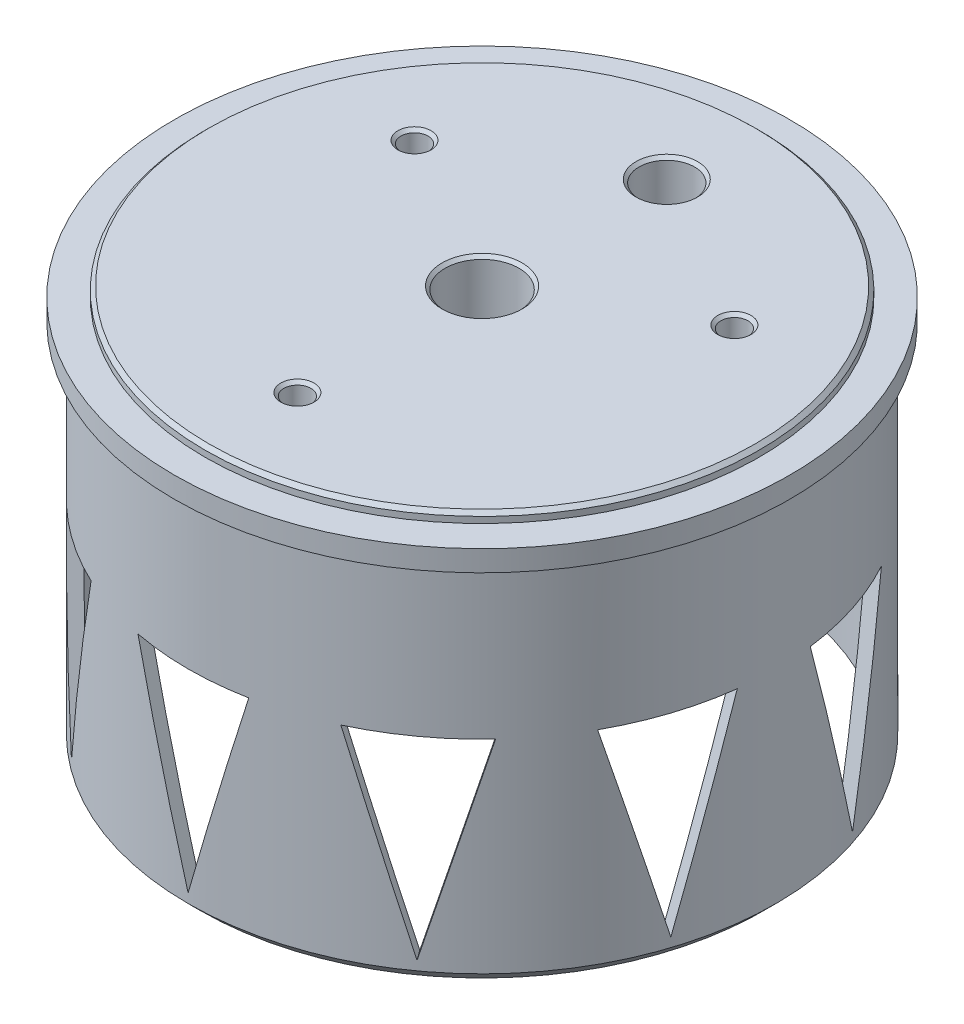
from build123d import *
from build123d.topology import SkipClean

# Parameters (mm, degrees)
CUT_EXTRUDE_748_DEPTH      = 70.85
PATTERN_CIRCULAR_802_COUNT = 5
SKETCH_7_R                 = 50
EXTRUDE_1_DEPTH            = 5
CUT_EXTRUDE_START          = -1.6
SKETCH_8_R                 = 50
SKETCH_8_R_2               = 45
CUT_EXTRUDE_1_DEPTH        = 1.6
SKETCH_9_R                 = 6
CUT_EXTRUDE_2_DEPTH        = 97.046863561
SKETCH_10_R                = 4.5
CUT_EXTRUDE_4_DEPTH        = 97.046863561
SKETCH_10_4_R              = 2.2
CUT_EXTRUDE_5_DEPTH        = 8
CHAMFER_1_SIZE             = 0.5
CHAMFER_2_SIZE             = 0.5
CHAMFER_3_SIZE             = 5
EXTRUDE_START              = 7
EXTRUDE_2_DEPTH            = 7
CHAMFER_4_SIZE             = 1
CHAMFER_5_SIZE             = 2
CHAMFER_6_SIZE             = 0.6


with BuildPart() as part:
    # Эскиз2 → Revolve 380 (revolve)
    with BuildSketch(Plane.XY, mode=Mode.PRIVATE) as revolve_380_sk:
        with BuildLine():
            Line((0, 0), (-47.75, 0))
            Line((-47.75, 0), (-47.75, -60))
            Line((-47.75, -60), (-45.75, -60))
            Line((-45.75, -60), (-45.75, -21))
            ThreePointArc((-45.75, -21), (-44.871320344, -18.878679656), (-42.75, -18))
            Line((-42.75, -18), (0, -18))
            Line((0, -18), (0, 0))
        make_face()
    revolve(revolve_380_sk.sketch.rotate(Axis((0, 0, 0), (0, 1, 0)), 270), axis=Axis((0, 0, 0), (0, 1, 0)))

    # Эскиз4 → Cut-Extrude 748 (cut, symmetric)
    with BuildSketch(Plane.XY):
        Polygon((-9, -25), (0, -56.5), (9, -25), align=None)
    cut_extrude_748 = extrude(amount=CUT_EXTRUDE_748_DEPTH, both=True, mode=Mode.SUBTRACT)

    # Pattern Circular 802: Cut-Extrude 748 ×5 about axis
    pattern_circular_802_axis = Axis((0, 0, 0), (0, 1, 0))
    for i in range(1, PATTERN_CIRCULAR_802_COUNT):
        add(cut_extrude_748.rotate(pattern_circular_802_axis, i * 360 / PATTERN_CIRCULAR_802_COUNT), mode=Mode.SUBTRACT)

    # Эскиз7 → Бобышка-Вытянуть1 (add)
    with BuildSketch(Plane(origin=(0, 0, 0), x_dir=(1, 0, 0), z_dir=(0, 1, 0))):
        with Locations(Location((0, 0, 0), (0, 0, 270))):
            Circle(SKETCH_7_R)
    extrude(amount=EXTRUDE_1_DEPTH)

    # Эскиз8 → Вырез-Вытянуть1 (cut)
    with BuildSketch(Plane(origin=(0, 5, 0), x_dir=(1, 0, 0), z_dir=(0, 1, 0)).offset(CUT_EXTRUDE_START)):
        with Locations(Location((0, 0, 0), (0, 0, 270))):
            Circle(SKETCH_8_R)
        with Locations(Location((0, 0, 0), (0, 0, 270))):
            Circle(SKETCH_8_R_2, mode=Mode.SUBTRACT)
    extrude(amount=CUT_EXTRUDE_1_DEPTH, mode=Mode.SUBTRACT)

    # Эскиз9 → Вырез-Вытянуть2 (cut, through all)
    with BuildSketch(Plane(origin=(0, 5, 0), x_dir=(1, 0, 0), z_dir=(0, 1, 0))):
        with Locations(Location((0, 0, 0), (0, 0, 270))):
            Circle(SKETCH_9_R)
    extrude(amount=-CUT_EXTRUDE_2_DEPTH, mode=Mode.SUBTRACT)

    # Эскиз10 → Вырез-Вытянуть4 (cut, through all)
    with BuildSketch(Plane(origin=(0, 5, 0), x_dir=(1, 0, 0), z_dir=(0, 1, 0))):
        with Locations(Location((0, 30, 0), (0, 0, 270))):
            Circle(SKETCH_10_R)
    extrude(amount=-CUT_EXTRUDE_4_DEPTH, mode=Mode.SUBTRACT)

    # Эскиз10<4> → Вырез-Вытянуть5 (cut)
    with BuildSketch(Plane(origin=(0, 5, 0), x_dir=(1, 0, 0), z_dir=(0, 1, 0))):
        with Locations(Location((0, -30, 0), (0, 0, 270))):
            Circle(SKETCH_10_4_R)
        with Locations(Location((-25.980762114, 15, 0), (0, 0, 270))):
            Circle(SKETCH_10_4_R)
        with Locations(Location((25.980762114, 15, 0), (0, 0, 270))):
            Circle(SKETCH_10_4_R)
    extrude(amount=-CUT_EXTRUDE_5_DEPTH, mode=Mode.SUBTRACT)

    # Фаска1
    chamfer_1_edges = [part.edges().sort_by_distance(p)[0] for p in [
        (0, 5, -34.5),
        (-25.980762114, 5, -17.2),
        (25.980762114, 5, -17.2),
        (0, 5, 27.8),
    ]]
    chamfer(chamfer_1_edges, length=CHAMFER_1_SIZE)

    # Фаска2
    chamfer_2_edges = [part.edges().sort_by_distance(p)[0] for p in [
        (0, 5, -6),
    ]]
    chamfer(chamfer_2_edges, length=CHAMFER_2_SIZE)

    # Фаска3
    chamfer_3_edges = [part.edges().sort_by_distance(p)[0] for p in [
        (0, -18, -6),
        (0, -18, -34.5),
    ]]
    chamfer(chamfer_3_edges, length=CHAMFER_3_SIZE)

    # Эскиз13 → Бобышка-Вытянуть2 (add)
    with SkipClean():  # the faces are left unmerged after this step: merging them gives an invalid solid
        with BuildSketch(Plane.XZ.offset(EXTRUDE_START)):
            with BuildLine():
                Line((-1.91, -47.711784708), (-2, -49.959983987))
                ThreePointArc((-2, -49.959983987), (0, -50), (2, -49.959983987))
                Line((2, -49.959983987), (1.91, -47.711784708))
                ThreePointArc((1.91, -47.711784708), (0, -47.75), (-1.91, -47.711784708))
            make_face()
        extrude(amount=-EXTRUDE_2_DEPTH)

    # Фаска4
    chamfer_4_edges = [part.edges().sort_by_distance(p)[0] for p in [
        (1.955, -7, -48.835884347),
        (-1.955, -7, -48.835884347),
    ]]
    chamfer(chamfer_4_edges, length=CHAMFER_4_SIZE)

    # Фаска5
    chamfer_5_edges = [part.edges().sort_by_distance(p)[0] for p in [
        (0, -60, 47.75),
    ]]
    chamfer(chamfer_5_edges, length=CHAMFER_5_SIZE - 0.0001)  # a hair under: the kernel refuses the full size

    # Фаска6
    chamfer_6_edges = [part.edges().sort_by_distance(p)[0] for p in [
        (0, 5, -45),
    ]]
    chamfer(chamfer_6_edges, length=CHAMFER_6_SIZE)


solid = part.part
